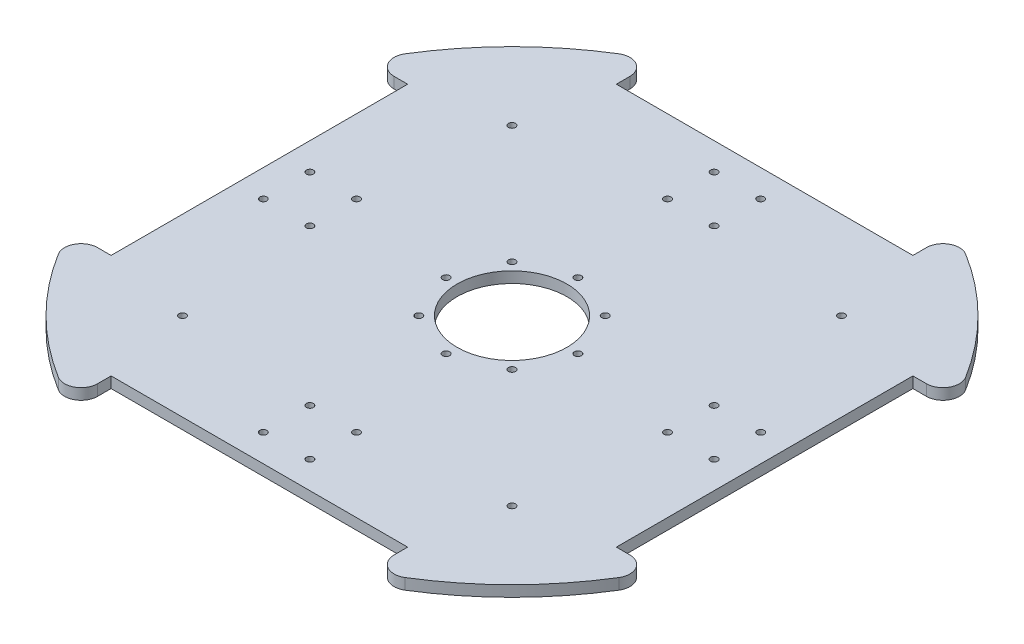
from build123d import *

# Parameters (mm, degrees)
BOSS_EXTRUDE1_DEPTH     = 5
FILLET1_R               = 7.5
CUT_EXTRUDE2_DEPTH      = 183.030179489
CUT_EXTRUDE2_DEPTH_BACK = 183.030179489
SKETCH3_R               = 1.6
CUT_EXTRUDE3_DEPTH      = 183.030179489
CUT_EXTRUDE3_DEPTH_BACK = 183.030179489
SKETCH4_R               = 25
SKETCH4_R_2             = 1.6
CUT_EXTRUDE4_DEPTH      = 183.030179489
CUT_EXTRUDE4_DEPTH_BACK = 183.030179489
SKETCH5_R               = 1.6


with BuildPart() as part:
    # Sketch1 → Boss-Extrude1 (new body)
    with BuildSketch(Plane(origin=(0, 0, 0), x_dir=(1, 0, 0), z_dir=(0, 1, 0))):
        with BuildLine():
            Line((115, 67.5), (133.954283246, 67.5))
            ThreePointArc((133.954283246, 67.5), (106.066017178, 106.066017178), (67.5, 133.954283246))
            Line((67.5, 133.954283246), (67.5, 115))
            Line((67.5, 115), (-67.5, 115))
            Line((-67.5, 115), (-67.5, 133.954283246))
            ThreePointArc((-67.5, 133.954283246), (-106.066017178, 106.066017178), (-133.954283246, 67.5))
            Line((-133.954283246, 67.5), (-115, 67.5))
            Line((-115, 67.5), (-115, -67.5))
            Line((-115, -67.5), (-133.954283246, -67.5))
            ThreePointArc((-133.954283246, -67.5), (-106.066017178, -106.066017178), (-67.5, -133.954283246))
            Line((-67.5, -133.954283246), (-67.5, -115))
            Line((-67.5, -115), (67.5, -115))
            Line((67.5, -115), (67.5, -133.954283246))
            ThreePointArc((67.5, -133.954283246), (106.066017178, -106.066017178), (133.954283246, -67.5))
            Line((133.954283246, -67.5), (115, -67.5))
            Line((115, -67.5), (115, 67.5))
        make_face()
    extrude(amount=BOSS_EXTRUDE1_DEPTH)

    # Fillet1
    fillet1_edges = [part.edges().sort_by_distance(p)[0] for p in [
        (-133.954283246, 2.5, 67.5),
        (-133.954283246, 2.5, -67.5),
        (-67.5, 2.5, -133.954283246),
        (67.5, 2.5, -133.954283246),
        (133.954283246, 2.5, -67.5),
        (133.954283246, 2.5, 67.5),
        (67.5, 2.5, 133.954283246),
        (-67.5, 2.5, 133.954283246),
    ]]
    fillet(fillet1_edges, radius=FILLET1_R)

    # Sketch3 → Cut-Extrude2 (cut, two sides: drawn at the far end of the back side and taken through both)
    with BuildSketch(Plane(origin=(0, 5, 0), x_dir=(1, 0, 0), z_dir=(0, 1, 0)).offset(-CUT_EXTRUDE2_DEPTH_BACK)):
        with Locations((-10.606601718, -102.606601718)):
            Circle(SKETCH3_R)
        with Locations((-10.606601718, -81.393398282)):
            Circle(SKETCH3_R)
        with Locations((10.606601718, -81.393398282)):
            Circle(SKETCH3_R)
        with Locations((10.606601718, -102.606601718)):
            Circle(SKETCH3_R)
        with Locations((-81.393398282, 10.606601718)):
            Circle(SKETCH3_R)
        with Locations((-81.393398282, -10.606601718)):
            Circle(SKETCH3_R)
        with Locations((-102.606601718, -10.606601718)):
            Circle(SKETCH3_R)
        with Locations((-102.606601718, 10.606601718)):
            Circle(SKETCH3_R)
        with Locations((10.606601718, 81.393398282)):
            Circle(SKETCH3_R)
        with Locations((-10.606601718, 81.393398282)):
            Circle(SKETCH3_R)
        with Locations((-10.606601718, 102.606601718)):
            Circle(SKETCH3_R)
        with Locations((10.606601718, 102.606601718)):
            Circle(SKETCH3_R)
        with Locations((81.393398282, -10.606601718)):
            Circle(SKETCH3_R)
        with Locations((81.393398282, 10.606601718)):
            Circle(SKETCH3_R)
        with Locations((102.606601718, 10.606601718)):
            Circle(SKETCH3_R)
        with Locations((102.606601718, -10.606601718)):
            Circle(SKETCH3_R)
    extrude(amount=CUT_EXTRUDE2_DEPTH + CUT_EXTRUDE2_DEPTH_BACK, mode=Mode.SUBTRACT)

    # Sketch4 → Cut-Extrude3 (cut, two sides: drawn at the far end of the back side and taken through both)
    with BuildSketch(Plane(origin=(0, 5, 0), x_dir=(1, 0, 0), z_dir=(0, 1, 0)).offset(-CUT_EXTRUDE3_DEPTH_BACK)):
        Circle(SKETCH4_R)
        with Locations((0, 30)):
            Circle(SKETCH4_R_2)
        with Locations((21.213203436, 21.213203436)):
            Circle(SKETCH4_R_2)
        with Locations((30, 0)):
            Circle(SKETCH4_R_2)
        with Locations((21.213203436, -21.213203436)):
            Circle(SKETCH4_R_2)
        with Locations((0, -30)):
            Circle(SKETCH4_R_2)
        with Locations((-21.213203436, -21.213203436)):
            Circle(SKETCH4_R_2)
        with Locations((-30, 0)):
            Circle(SKETCH4_R_2)
        with Locations((-21.213203436, 21.213203436)):
            Circle(SKETCH4_R_2)
    extrude(amount=CUT_EXTRUDE3_DEPTH + CUT_EXTRUDE3_DEPTH_BACK, mode=Mode.SUBTRACT)

    # Sketch5 → Cut-Extrude4 (cut, two sides: drawn at the far end of the back side and taken through both)
    with BuildSketch(Plane(origin=(0, 5, 0), x_dir=(1, 0, 0), z_dir=(0, 1, 0)).offset(-CUT_EXTRUDE4_DEPTH_BACK)):
        with Locations((75, -75)):
            Circle(SKETCH5_R)
        with Locations((-75, -75)):
            Circle(SKETCH5_R)
        with Locations((75, 75)):
            Circle(SKETCH5_R)
        with Locations((-75, 75)):
            Circle(SKETCH5_R)
    extrude(amount=CUT_EXTRUDE4_DEPTH + CUT_EXTRUDE4_DEPTH_BACK, mode=Mode.SUBTRACT)


solid = part.part
